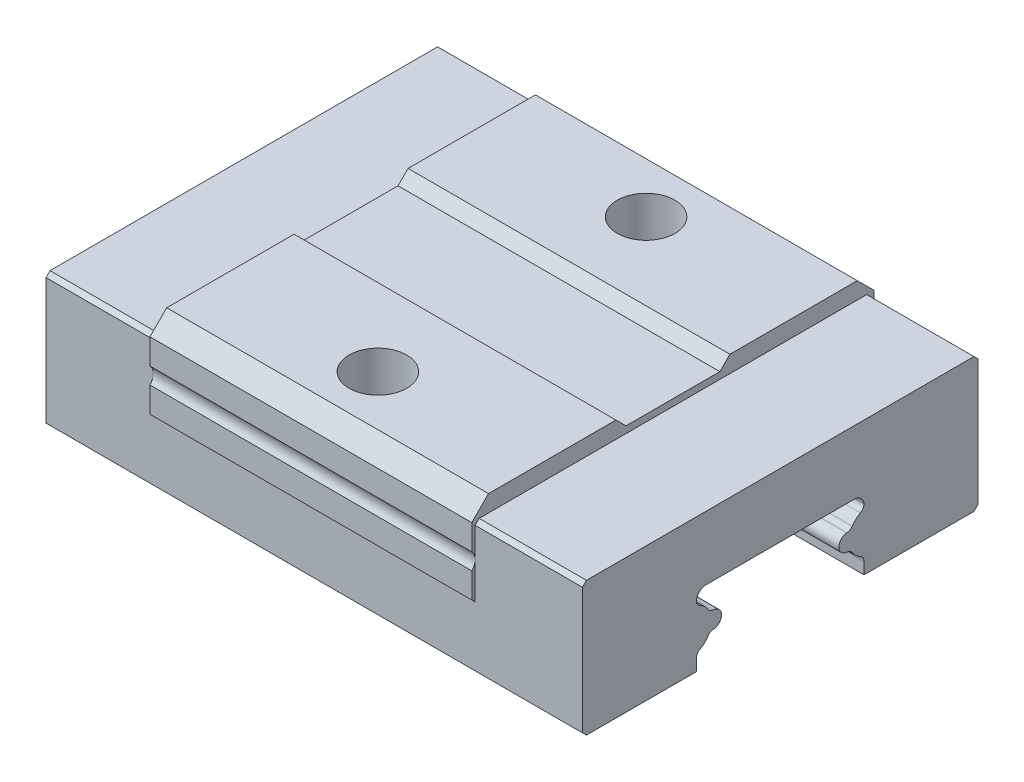
from build123d import *

# Parameters (mm, degrees)
EXTRUDE_1_DEPTH     = 8
EXTRUDE_2_DEPTH     = 4.8
EXTRUDE_3_DEPTH     = 16
CUT_EXTRUDE_1_DEPTH = 15.747203125
CUT_EXTRUDE_START   = -4.8
SKETCH_5_R          = 0.35
CUT_EXTRUDE_2_DEPTH = 9.6
CHAMFER_1_SIZE      = 0.12
FILLET_1_R          = 0.2
FILLET_2_R          = 0.3
SKETCH_12_R         = 0.86
CUT_EXTRUDE_4_DEPTH = 1.5


with BuildPart() as part:
    # 草图1 → 凸台-拉伸1 (new, symmetric)
    with BuildSketch(Plane(origin=(0, 0, 0), x_dir=(0, 0, -1), z_dir=(1, 0, 0))):
        Polygon((-5.9, 3.7), (5.9, 3.7), (5.9, -0.3), (2.5, -0.3), (2.5, 1.8), (-2.5, 1.8), (-2.5, -0.3), (-5.9, -0.3), align=None)
    extrude(amount=EXTRUDE_1_DEPTH, both=True)

    # 草图2 → 凸台-拉伸2 (add, symmetric)
    with BuildSketch(Plane(origin=(0, 0, 0), x_dir=(0, 0, -1), z_dir=(1, 0, 0))):
        Polygon((6, 1.7), (6, 3.7), (5.5, 4.2), (-5.5, 4.2), (-6, 3.7), (-6, 1.7), (-5.9, 1.6), (-5.9, 3.7), (5.9, 3.7), (5.9, 1.6), align=None)
    extrude(amount=EXTRUDE_2_DEPTH, both=True)

    # 草图11 → 凸台-拉伸3 (add)
    with BuildSketch(Plane(origin=(8, 0, 0), x_dir=(0, 0, -1), z_dir=(1, 0, 0))):
        with BuildLine():
            Line((-2, 1.042), (-2.1, 1.042))
            ThreePointArc((-2.1, 1.042), (-2.260324923, 1.265329695), (-2.5, 1.4))
            Line((-2.5, 1.4), (-2.5, 0.184))
            ThreePointArc((-2.5, 0.184), (-2.260324923, 0.318670305), (-2.1, 0.542))
            Line((-2.1, 0.542), (-2, 0.542))
            ThreePointArc((-2, 0.542), (-1.75, 0.792), (-2, 1.042))
        make_face()
        with BuildLine():
            Line((2.5, 1.4), (2.5, 0.184))
            ThreePointArc((2.5, 0.184), (2.260324923, 0.318670305), (2.1, 0.542))
            Line((2.1, 0.542), (2, 0.542))
            ThreePointArc((2, 0.542), (1.75, 0.792), (2, 1.042))
            Line((2, 1.042), (2.1, 1.042))
            ThreePointArc((2.1, 1.042), (2.260324923, 1.265329695), (2.5, 1.4))
        make_face()
    extrude(amount=-EXTRUDE_3_DEPTH)

    # 草图3 → 切除-拉伸1 (cut, through all)
    with BuildSketch(Plane.ZY.offset(4.8)):
        Polygon((1.7, 4.2), (1.4, 3.9), (-1.4, 3.9), (-1.7, 4.2), align=None)
    extrude(amount=-CUT_EXTRUDE_1_DEPTH, mode=Mode.SUBTRACT)

    # 草图5 → 切除-拉伸2 (cut)
    with BuildSketch(Plane(origin=(0, 0, 0), x_dir=(0, 0, -1), z_dir=(1, 0, 0)).offset(CUT_EXTRUDE_START)):
        with Locations((-6.25, 2.7)):
            Circle(SKETCH_5_R)
    extrude(amount=CUT_EXTRUDE_2_DEPTH, mode=Mode.SUBTRACT)

    # 倒角1
    chamfer_1_edges = [part.edges().sort_by_distance(p)[0] for p in [
        (0, -0.3, 5.9),
        (6.4, 3.7, 5.9),
        (6.4, 3.7, -5.9),
        (0, -0.3, -5.9),
        (-6.4, 3.7, 5.9),
        (-6.4, 3.7, -5.9),
    ]]
    chamfer(chamfer_1_edges, length=CHAMFER_1_SIZE)

    # 圆角1
    fillet_1_edges = [part.edges().sort_by_distance(p)[0] for p in [
        (0, 0.184, -2.5),
        (0, 0.542, -2.1),
        (0, 1.042, -2.1),
        (0, 1.4, -2.5),
        (0, 0.184, 2.5),
        (0, 0.542, 2.1),
        (0, 1.042, 2.1),
        (0, 1.4, 2.5),
    ]]
    fillet(fillet_1_edges, radius=FILLET_1_R)

    # 圆角2
    # the kernel refuses this fillet: 0.3 mm, written as the material it adds along each edge
    with BuildSketch(Plane(origin=(8, 1.8, 2.5), x_dir=(0, -1, 0), z_dir=(-1, 0, 0))) as fillet_2_piece_1:
        with BuildLine():
            CenterArc((0.3, -0.298097301), FILLET_2_R, 96.456420664, 83.543579336)
            Line((0, -0.298097301), (-0.006, -0.298097301))
            Line((-0.006, -0.298097301), (-0.006, 0))
            Line((-0.006, 0), (0, 0.006))
            ThreePointArc((0, 0.006), (0.13313288, 0.006), (0.265591075, 0.005961946))
            Line((0.265591075, 0.005961946), (0.26626576, 0))
        make_face()
    extrude(amount=16)
    with BuildSketch(Plane(origin=(8, 1.8, -2.5), x_dir=(0, 0, 1), z_dir=(-1, 0, 0))) as fillet_2_piece_2:
        with BuildLine():
            CenterArc((0.298097301, -0.3), FILLET_2_R, 90, 83.543579336)
            Line((0, -0.26626576), (-0.005961946, -0.265591075))
            ThreePointArc((-0.005961946, -0.265591075), (-0.006, -0.13313288), (-0.006, 0))
            Line((-0.006, 0), (0, 0.006))
            Line((0, 0.006), (0.298097301, 0.006))
            Line((0.298097301, 0.006), (0.298097301, 0))
        make_face()
    extrude(amount=16)

    # 草图12 → 切除-拉伸4 (cut)
    with BuildSketch(Plane(origin=(0, 4.2, 0), x_dir=(1, 0, 0), z_dir=(0, 1, 0))):
        with Locations(Location((0, 4, 0), (0, 0, 270))):
            Circle(SKETCH_12_R)
        with Locations(Location((0, -4, 0), (0, 0, 270))):
            Circle(SKETCH_12_R)
    extrude(amount=-CUT_EXTRUDE_4_DEPTH, mode=Mode.SUBTRACT)


solid = part.part
